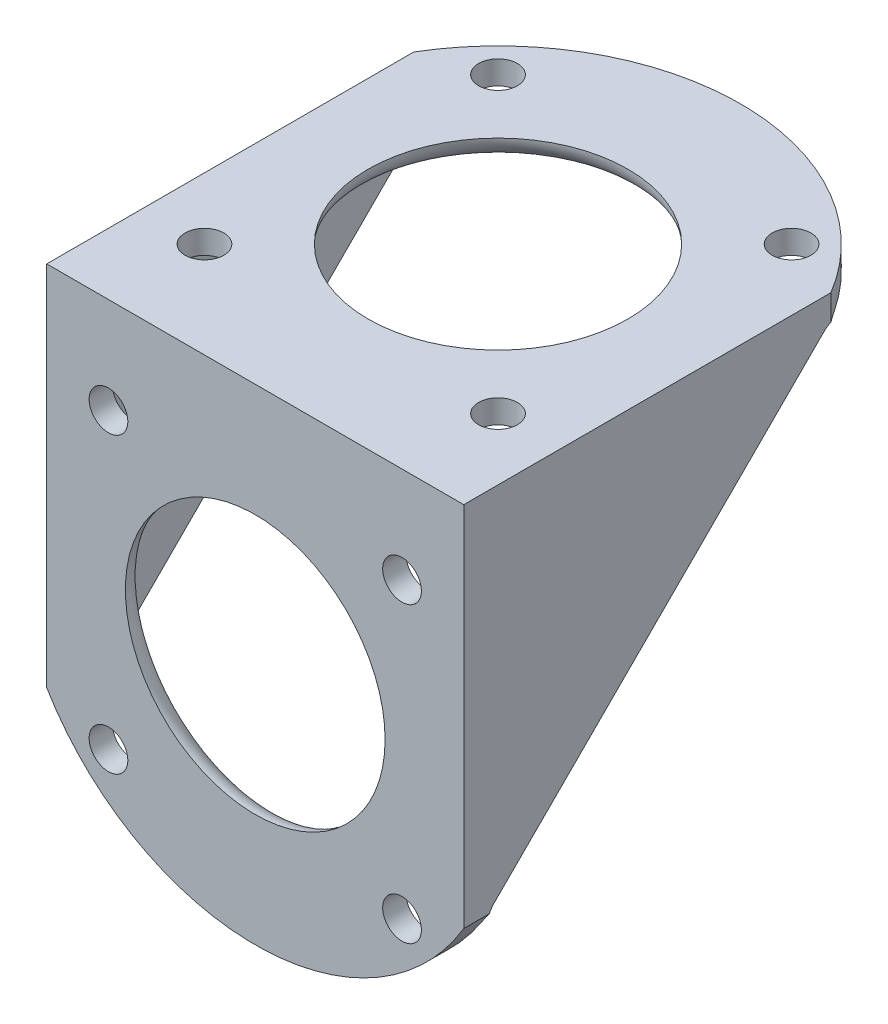
from build123d import *

# Parameters (mm, degrees)
SKETCH1_R           = 1.651
SKETCH1_R_2         = 11.07313
BOSS_EXTRUDE1_DEPTH = 2
BOSS_EXTRUDE2_DEPTH = 2
FILLET2_R           = 2
FILLET3_R           = 2


with BuildPart() as part:
    # Sketch1 → Boss-Extrude1 (new body)
    with BuildSketch(Plane.XY):
        with BuildLine():
            Line((-17.78, -10.602028155), (-17.78, 20.701))
            Line((-17.78, 20.701), (17.78, 20.701))
            Line((17.78, 20.701), (17.78, -10.602028155))
            ThreePointArc((17.78, -10.602028155), (0, -20.701), (-17.78, -10.602028155))
        make_face()
        with Locations((-12.515790027, -12.515790027)):
            Circle(SKETCH1_R, mode=Mode.SUBTRACT)
        with Locations((12.515790027, -12.515790027)):
            Circle(SKETCH1_R, mode=Mode.SUBTRACT)
        with Locations((12.515790027, 12.515790027)):
            Circle(SKETCH1_R, mode=Mode.SUBTRACT)
        with Locations((-12.515790027, 12.515790027)):
            Circle(SKETCH1_R, mode=Mode.SUBTRACT)
        Circle(SKETCH1_R_2, mode=Mode.SUBTRACT)
    boss_extrude1 = extrude(amount=BOSS_EXTRUDE1_DEPTH)

    # Mirror1: Boss-Extrude1 across plane
    add(boss_extrude1.mirror(Plane(origin=(0, 9.3505, -9.3505), x_dir=(0, 0.7071067811865465, 0.7071067811865486), z_dir=(0, -0.7071067811865488, 0.7071067811865464))))

    # Sketch2 → Boss-Extrude2 (add)
    with BuildSketch(Plane.ZY.offset(17.78)):
        Polygon((0, -10.602028155), (-29.303028155, 18.701), (0, 18.701), align=None)
    boss_extrude2 = extrude(amount=-BOSS_EXTRUDE2_DEPTH)

    # Mirror2: Boss-Extrude2 across plane
    add(boss_extrude2.mirror(Plane(origin=(0, 0, 0), x_dir=(0, 0, 1), z_dir=(1, 0, 0))))

    # Fillet2
    fillet2_edges = [part.edges().sort_by_distance(p)[0] for p in [
        (-11.07313, 0, 0),
        (-11.07313, 18.701, -18.701),
    ]]
    fillet(fillet2_edges, radius=FILLET2_R - 0.0001)  # a hair under: the kernel refuses the full size

    # Fillet3
    fillet3_edges = [part.edges().sort_by_distance(p)[0] for p in [
        (-16.78, -10.602028155, 0),
        (-16.78, 18.701, -29.303028155),
        (16.78, -10.602028155, 0),
        (16.78, 18.701, -29.303028155),
    ]]
    fillet(fillet3_edges, radius=FILLET3_R)


solid = part.part
